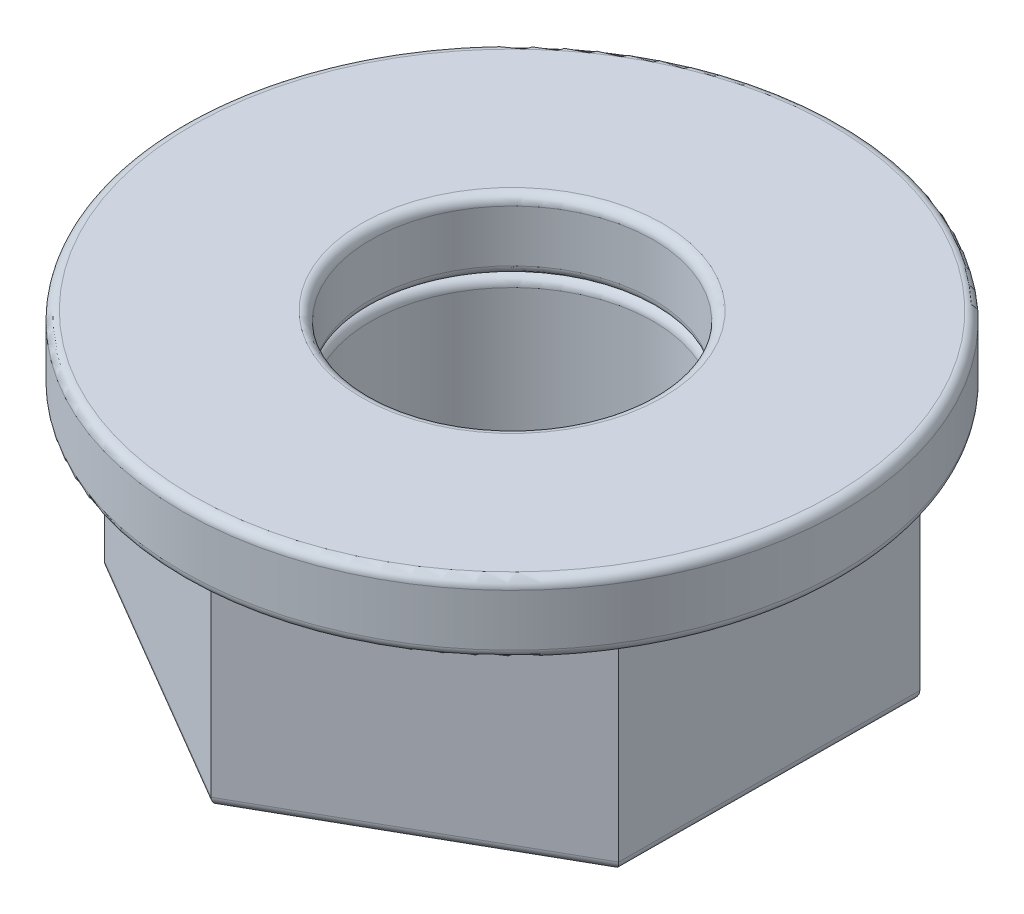
from build123d import *

# Parameters (mm, degrees)
SKETCH1_R           = 1.5
BOSS_EXTRUDE1_DEPTH = 2.25
FILLET1_R           = 0.1
SKETCH2_R           = 3.5
SKETCH2_R_2         = 1.5
BOSS_EXTRUDE2_DEPTH = 0.75
FILLET2_R           = 0.1


with BuildPart() as part:
    # Sketch1 → Boss-Extrude1 (new body)
    with BuildSketch(Plane(origin=(0, 0, 0), x_dir=(1, 0, 0), z_dir=(0, 1, 0))):
        Polygon((2.739003368, -1.606609438), (2.760866271, 1.568741778), (0.021862903, 3.175351216), (-2.739003368, 1.606609438), (-2.760866271, -1.568741778), (-0.021862903, -3.175351216), align=None)
        with Locations(Location((0, 0, 0), (0, 0, 270))):
            Circle(SKETCH1_R, mode=Mode.SUBTRACT)
    extrude(amount=BOSS_EXTRUDE1_DEPTH)

    # Fillet1
    fillet1_edges = [part.edges().sort_by_distance(p)[0] for p in [
        (1.391364587, 2.25, -2.372046497),
        (-1.358570232, 2.25, -2.390980327),
        (-2.749934819, 2.25, -0.01893383),
        (0, 0, -1.5),
        (0, 2.25, -1.5),
        (-1.391364587, 2.25, 2.372046497),
        (1.358570232, 2.25, 2.390980327),
        (-1.391364587, 0, 2.372046497),
        (-2.749934819, 0, -0.01893383),
        (-1.358570232, 0, -2.390980327),
        (2.749934819, 2.25, 0.01893383),
        (1.391364587, 0, -2.372046497),
        (2.749934819, 0, 0.01893383),
        (1.358570232, 0, 2.390980327),
    ]]
    fillet(fillet1_edges, radius=FILLET1_R)

    # Sketch2 → Boss-Extrude2 (add)
    with BuildSketch(Plane(origin=(0, 2.25, 0), x_dir=(1, 0, 0), z_dir=(0, 1, 0))):
        with Locations(Location((0, 0, 0), (0, 0, 270))):
            Circle(SKETCH2_R)
        with Locations(Location((0, 0, 0), (0, 0, 270))):
            Circle(SKETCH2_R_2, mode=Mode.SUBTRACT)
    extrude(amount=BOSS_EXTRUDE2_DEPTH)

    # Fillet2
    fillet2_edges = [part.edges().sort_by_distance(p)[0] for p in [
        (0, 2.25, -1.5),
        (0, 3, -3.5),
        (0, 2.25, -3.5),
        (0, 3, -1.5),
    ]]
    fillet(fillet2_edges, radius=FILLET2_R - 0.0001)  # a hair under: the kernel refuses the full size


solid = part.part
